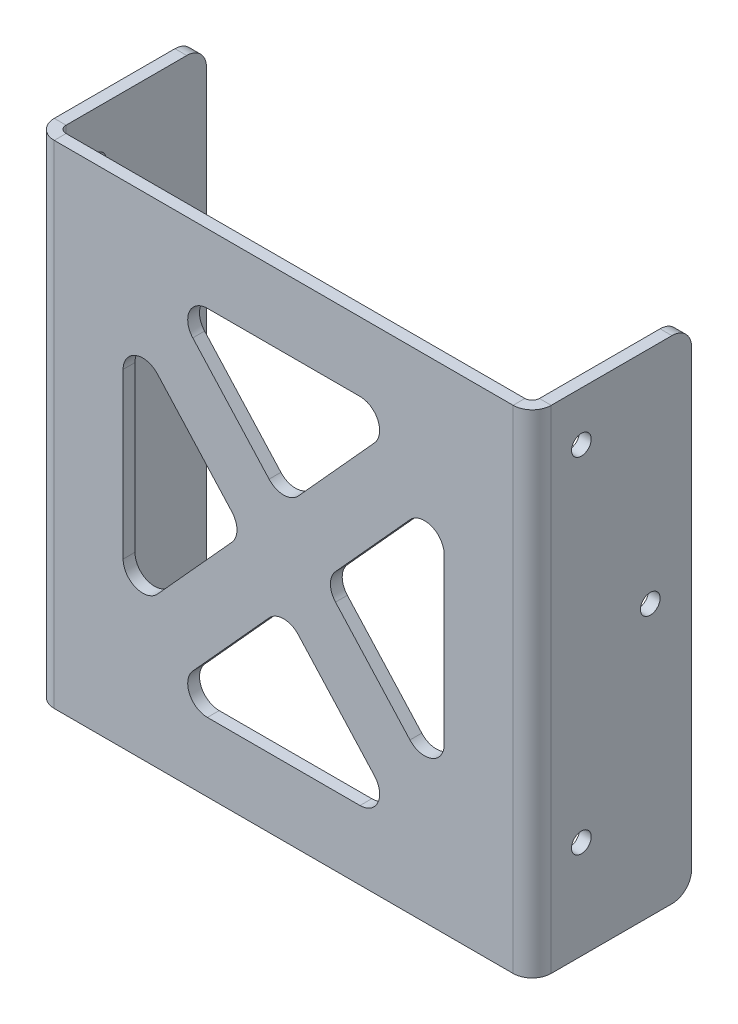
from build123d import *

# Parameters (mm, degrees)
SKETCH_1_W                         = 48.1
SKETCH_1_H                         = 50
SM_BASE_FLANGE_1_DEPTH             = 1.2
SM_EDGE_FLANGE_1_STRIP_W           = 6.2732
SM_EDGE_FLANGE_1_STRIP_H           = 1.2
SM_EDGE_FLANGE_1_STRIP_CUT_DEPTH   = 50
SM_EDGE_FLANGE_1_STRIP_2_W         = 6.2732
SM_EDGE_FLANGE_1_STRIP_2_H         = 1.2
SM_EDGE_FLANGE_1_STRIP_CUT_2_DEPTH = 50
SM_EDGE_FLANGE_1_DEPTH             = 50
SM_EDGE_FLANGE_1_BEND_DEPTH        = 50
CUT_EXTRUDE_1_DEPTH                = 10
SKETCH_17_R                        = 1
CUT_EXTRUDE_2_DEPTH                = 59.631817301
FILLET_1_R                         = 2


# Sheet-metal steps are written as plain solids
with BuildPart() as part:
    # Sketch 1 → 基材-凸緣1 (new body)
    with BuildSketch(Plane.XY):
        Rectangle(SKETCH_1_W, SKETCH_1_H)
    extrude(amount=-SM_BASE_FLANGE_1_DEPTH)

    # 邊線-凸緣1 strip (across the edge) → 邊線-凸緣1 strip cut (cut)
    with BuildSketch(Plane(origin=(24.05, 25, -1.2), x_dir=(-1, 0, 0), z_dir=(0, -1, 0))):
        with Locations((-2.4, -0.6)):
            Rectangle(SM_EDGE_FLANGE_1_STRIP_W, SM_EDGE_FLANGE_1_STRIP_H)
    extrude(amount=SM_EDGE_FLANGE_1_STRIP_CUT_DEPTH, mode=Mode.SUBTRACT)

    # 邊線-凸緣1 strip 2 (across the edge) → 邊線-凸緣1 strip cut 2 (cut)
    with BuildSketch(Plane(origin=(-24.05, -25, -1.2), x_dir=(1, 0, 0), z_dir=(0, 1, 0))):
        with Locations((-2.4, -0.6)):
            Rectangle(SM_EDGE_FLANGE_1_STRIP_2_W, SM_EDGE_FLANGE_1_STRIP_2_H)
    extrude(amount=SM_EDGE_FLANGE_1_STRIP_CUT_2_DEPTH, mode=Mode.SUBTRACT)

    # 邊線-凸緣1 section (across the edge) → 邊線-凸緣1 (add)
    with BuildSketch(Plane(origin=(24.05, 25, -1.2), x_dir=(-1, 0, 0), z_dir=(0, -1, 0))):
        with BuildLine():
            Line((-1.2, 0.7366), (-1.2, 15))
            Line((-1.2, 15), (0, 15))
            Line((0, 15), (0, 0.7366))
            ThreePointArc((0, 0.7366), (0.215745145, 0.215745145), (0.7366, 0))
            Line((0.7366, 0), (0.7366, -1.2))
            ThreePointArc((0.7366, -1.2), (-0.632782992, -0.632782992), (-1.2, 0.7366))
        make_face()
    extrude(amount=SM_EDGE_FLANGE_1_DEPTH)

    # 邊線-凸緣1 section 2 (across the edge) → 邊線-凸緣1 bend (add)
    with BuildSketch(Plane(origin=(-24.05, -25, -1.2), x_dir=(1, 0, 0), z_dir=(0, 1, 0))):
        with BuildLine():
            Line((-1.2, 0.7366), (-1.2, 15))
            Line((-1.2, 15), (0, 15))
            Line((0, 15), (0, 0.7366))
            ThreePointArc((0, 0.7366), (0.215745145, 0.215745145), (0.7366, 0))
            Line((0.7366, 0), (0.7366, -1.2))
            ThreePointArc((0.7366, -1.2), (-0.632782992, -0.632782992), (-1.2, 0.7366))
        make_face()
    extrude(amount=SM_EDGE_FLANGE_1_BEND_DEPTH)

    # 草圖14 → 除料-伸長1 (cut)
    with BuildSketch(Plane.XY):
        with BuildLine():
            Line((-7.752874967, 18), (7.752874967, 18))
            ThreePointArc((7.752874967, 18), (9.581283984, 16.810506303), (9.234812, 14.656920467))
            Line((9.234812, 14.656920467), (1.481937033, 6.10249592))
            ThreePointArc((1.481937033, 6.10249592), (0, 5.445575453), (-1.481937033, 6.10249592))
            Line((-1.481937033, 6.10249592), (-9.234812, 14.656920467))
            ThreePointArc((-9.234812, 14.656920467), (-9.581283984, 16.810506303), (-7.752874967, 18))
        make_face()
        with BuildLine():
            Line((-16.3134, 8.347649749), (-16.3134, -8.347649749))
            ThreePointArc((-16.3134, -8.347649749), (-15.033165911, -10.213644666), (-12.831462967, -9.690729281))
            Line((-12.831462967, -9.690729281), (-5.265988, -1.343079533))
            ThreePointArc((-5.265988, -1.343079533), (-4.747925033, 0), (-5.265988, 1.343079533))
            Line((-5.265988, 1.343079533), (-12.831462967, 9.690729281))
            ThreePointArc((-12.831462967, 9.690729281), (-15.033165911, 10.213644666), (-16.3134, 8.347649749))
        make_face()
        with BuildLine():
            Line((-7.752874967, -18), (7.752874967, -18))
            ThreePointArc((7.752874967, -18), (9.581283984, -16.810506303), (9.234812, -14.656920467))
            Line((9.234812, -14.656920467), (1.481937033, -6.10249592))
            ThreePointArc((1.481937033, -6.10249592), (0, -5.445575453), (-1.481937033, -6.10249592))
            Line((-1.481937033, -6.10249592), (-9.234812, -14.656920467))
            ThreePointArc((-9.234812, -14.656920467), (-9.581283984, -16.810506303), (-7.752874967, -18))
        make_face()
        with BuildLine():
            Line((16.3134, 8.347649749), (16.3134, -8.347649749))
            ThreePointArc((16.3134, -8.347649749), (15.033165911, -10.213644666), (12.831462967, -9.690729281))
            Line((12.831462967, -9.690729281), (5.265988, -1.343079533))
            ThreePointArc((5.265988, -1.343079533), (4.747925033, 0), (5.265988, 1.343079533))
            Line((5.265988, 1.343079533), (12.831462967, 9.690729281))
            ThreePointArc((12.831462967, 9.690729281), (15.033165911, 10.213644666), (16.3134, 8.347649749))
        make_face()
    extrude(amount=-CUT_EXTRUDE_1_DEPTH, mode=Mode.SUBTRACT)

    # 草圖17 → 除料-伸長2 (cut, through all)
    with BuildSketch(Plane(origin=(25.25, 0, 0), x_dir=(0, 0, -1), z_dir=(1, 0, 0))):
        with Locations((5, 20)):
            Circle(SKETCH_17_R)
        with Locations((5.000020411, -15)):
            Circle(SKETCH_17_R)
        with Locations((12, 2.5)):
            Circle(SKETCH_17_R)
    extrude(amount=-CUT_EXTRUDE_2_DEPTH, mode=Mode.SUBTRACT)

    # 圓角1
    fillet_1_edges = [part.edges().sort_by_distance(p)[0] for p in [
        (24.65, 25, -16.2),
        (24.65, -25, -16.2),
        (-24.65, -25, -16.2),
        (-24.65, 25, -16.2),
    ]]
    fillet(fillet_1_edges, radius=FILLET_1_R)


solid = part.part
